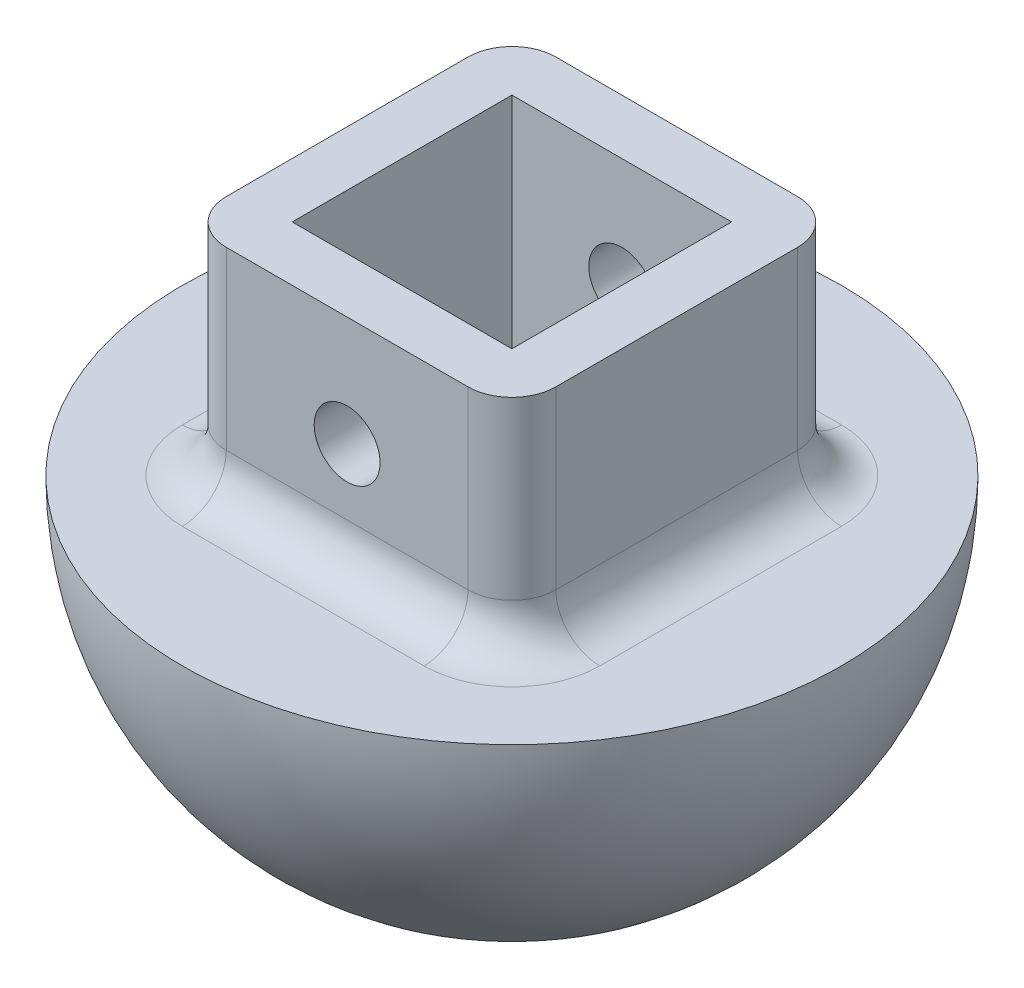
from build123d import *

# Parameters (mm, degrees)
REVOLVE2_ANGLE          = 180
SKETCH1_W               = 15
SKETCH1_H               = 15
SKETCH1_W_2             = 10
SKETCH1_H_2             = 10
BOSS_EXTRUDE1_DEPTH     = 10
CUT_EXTRUDE1_DEPTH      = 20
CUT_EXTRUDE1_DEPTH_BACK = 10
SKETCH2_R               = 1.5
FILLET1_R               = 2


with BuildPart() as part:
    # Sketch4 → Revolve2 (revolve)
    with BuildSketch(Plane(origin=(0, 0, 0), x_dir=(1, 0, 0), z_dir=(0, 1, 0))):
        with BuildLine():
            Line((15, 0), (-15, 0))
            ThreePointArc((-15, 0), (0, -15), (15, 0))
        make_face()
    revolve(axis=Axis((-15, 0, 0), (1, 0, 0)), revolution_arc=REVOLVE2_ANGLE)

    # Sketch1 → Boss-Extrude1 (add)
    with BuildSketch(Plane(origin=(0, 0, 0), x_dir=(1, 0, 0), z_dir=(0, 1, 0))):
        Rectangle(SKETCH1_W, SKETCH1_H)
        Rectangle(SKETCH1_W_2, SKETCH1_H_2, mode=Mode.SUBTRACT)
    extrude(amount=BOSS_EXTRUDE1_DEPTH)

    # Sketch2 → Cut-Extrude1 (cut, two sides: drawn at the far end of the back side and taken through both)
    with BuildSketch(Plane(origin=(0, 0, 5), x_dir=(-1, 0, 0), z_dir=(0, 0, -1)).offset(-CUT_EXTRUDE1_DEPTH_BACK)):
        with Locations((0, 5)):
            Circle(SKETCH2_R)
    extrude(amount=CUT_EXTRUDE1_DEPTH + CUT_EXTRUDE1_DEPTH_BACK, mode=Mode.SUBTRACT)

    # Fillet1
    fillet1_edges = [part.edges().sort_by_distance(p)[0] for p in [
        (-7.5, 5, 7.5),
        (-7.5, 5, -7.5),
        (7.5, 5, -7.5),
        (7.5, 5, 7.5),
        (0, 0, -7.5),
        (7.5, 0, 0),
        (-7.5, 0, 0),
        (0, 0, 7.5),
    ]]
    fillet(fillet1_edges, radius=FILLET1_R)


solid = part.part
